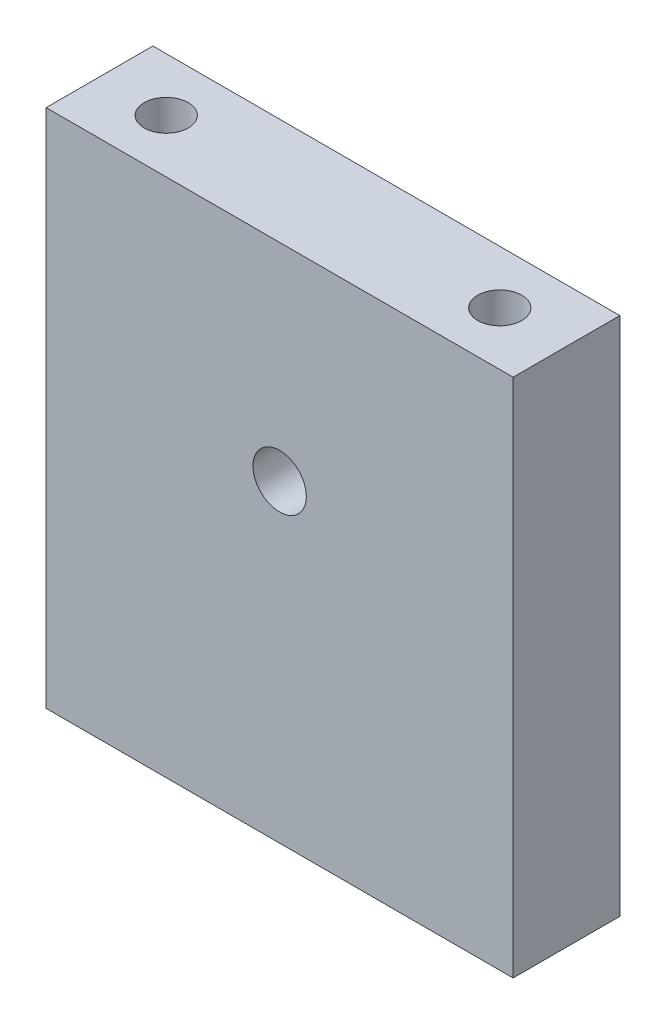
from build123d import *

# Parameters (mm, degrees)
SKETCH_1_W          = 35
SKETCH_1_H          = 39
SKETCH_1_R          = 2
EXTRUDE_1_DEPTH     = 8
SKETCH_2_R          = 1.65
CUT_EXTRUDE_1_DEPTH = 54.009433123


with BuildPart() as part:
    # 草图1 → 凸台-拉伸1 (new body)
    with BuildSketch(Plane.XY):
        with Locations((17.5, 19.5)):
            Rectangle(SKETCH_1_W, SKETCH_1_H)
        with Locations((17.5, 23.5)):
            Circle(SKETCH_1_R, mode=Mode.SUBTRACT)
    extrude(amount=EXTRUDE_1_DEPTH)

    # 草图2 → 切除-拉伸1 (cut, through all)
    with BuildSketch(Plane(origin=(0, 39, 0), x_dir=(1, 0, 0), z_dir=(0, 1, 0))):
        with Locations((5, -4)):
            Circle(SKETCH_2_R)
        with Locations((30, -4)):
            Circle(SKETCH_2_R)
    extrude(amount=-CUT_EXTRUDE_1_DEPTH, mode=Mode.SUBTRACT)


solid = part.part
